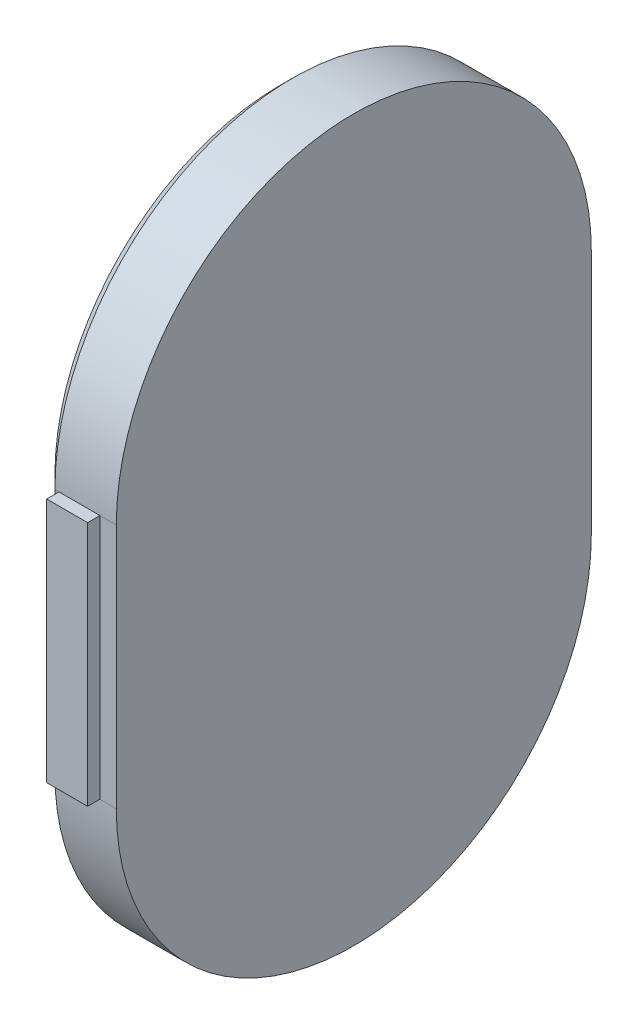
from build123d import *

# Parameters (mm, degrees)
BOSS_EXTRUDE1_START = -38
BOSS_EXTRUDE1_DEPTH = 1.8
CHAMFER1_SIZE       = 0.3
BOSS_EXTRUDE2_START = 82.2
SKETCH2_W           = 1
SKETCH2_H           = 6
BOSS_EXTRUDE2_DEPTH = 0.31
BOSS_EXTRUDE3_START = 94.09
SKETCH3_W           = 1
SKETCH3_H           = 6
BOSS_EXTRUDE3_DEPTH = 0.31
BOSS_EXTRUDE4_START = 86.8
SKETCH4_W           = 0.7
SKETCH4_H           = 1.3
BOSS_EXTRUDE4_DEPTH = 3


with BuildPart() as part:
    # Sketch1 → Boss-Extrude1 (new body)
    with BuildSketch(Plane(origin=(0, 0, 0), x_dir=(0, 0, -1), z_dir=(1, 0, 0)).offset(BOSS_EXTRUDE1_START)):
        with BuildLine():
            Line((-94.1, 53), (-94.1, 59))
            ThreePointArc((-94.1, 59), (-92.401219331, 63.101219331), (-88.3, 64.8))
            ThreePointArc((-88.3, 64.8), (-84.198780669, 63.101219331), (-82.5, 59))
            Line((-82.5, 59), (-82.5, 53))
            ThreePointArc((-82.5, 53), (-84.198780669, 48.898780669), (-88.3, 47.2))
            ThreePointArc((-88.3, 47.2), (-92.401219331, 48.898780669), (-94.1, 53))
        make_face()
    extrude(amount=BOSS_EXTRUDE1_DEPTH)

    # Chamfer1
    chamfer1_edges = [part.edges().sort_by_distance(p)[0] for p in [
        (-38, 47.2, 88.3),
        (-38, 56, 82.5),
        (-38, 56, 94.1),
        (-38, 64.8, 88.3),
    ]]
    chamfer(chamfer1_edges, length=CHAMFER1_SIZE)

    # Sketch2 → Boss-Extrude2 (add)
    with BuildSketch(Plane.XY.offset(BOSS_EXTRUDE2_START)):
        with Locations((-37.1, 56)):
            Rectangle(SKETCH2_W, SKETCH2_H)
    extrude(amount=BOSS_EXTRUDE2_DEPTH)

    # Sketch3 → Boss-Extrude3 (add)
    with BuildSketch(Plane.XY.offset(BOSS_EXTRUDE3_START)):
        with Locations((-37.1, 56)):
            Rectangle(SKETCH3_W, SKETCH3_H)
    extrude(amount=BOSS_EXTRUDE3_DEPTH)


with BuildPart() as body_2:
    # Sketch4 → Boss-Extrude4 (new body)
    with BuildSketch(Plane.XY.offset(BOSS_EXTRUDE4_START)):
        with Locations((-37.75, 47.75)):
            Rectangle(SKETCH4_W, SKETCH4_H)
    extrude(amount=BOSS_EXTRUDE4_DEPTH)


with BuildPart() as part_1:
    add(part.part)

    # Combine1: cut body 2
    add(body_2.part, mode=Mode.SUBTRACT)


solid = part_1.part
